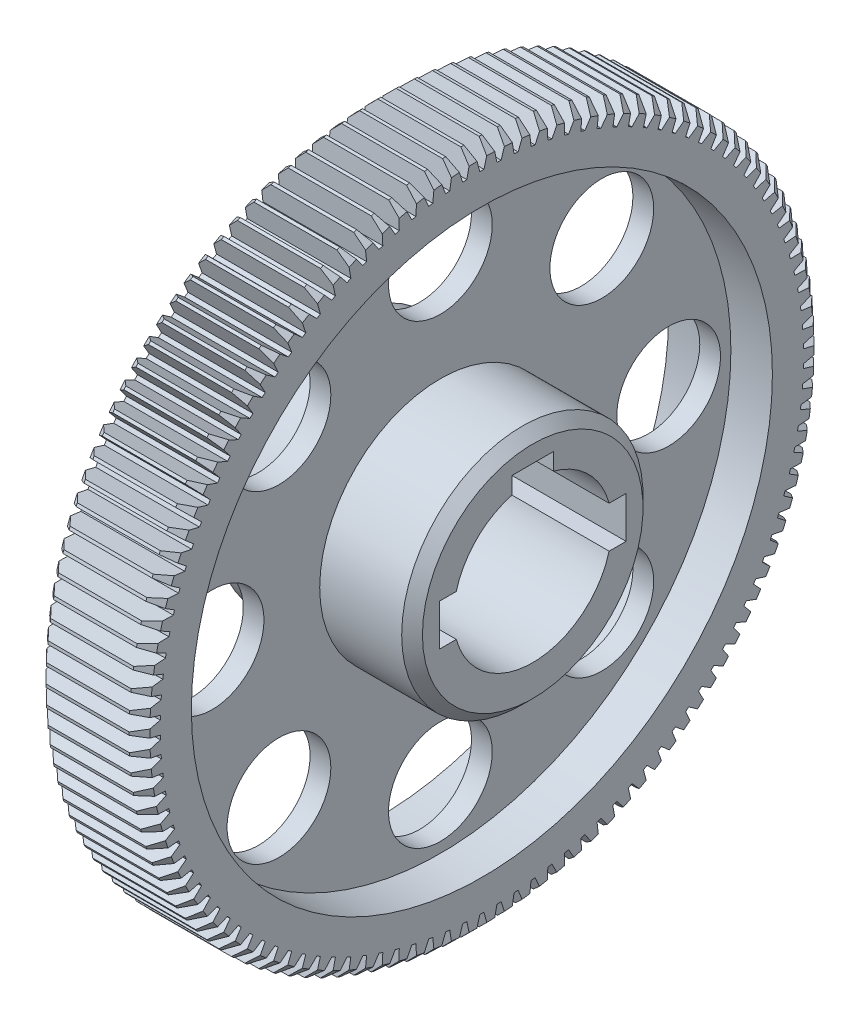
from build123d import *

# Parameters (mm, degrees)
CHAMFER_1_SIZE           = 5
SKETCH_3_R               = 25
CUT_EXTRUDE_1_DEPTH      = 10
CUT_EXTRUDE_2_REACH      = 255.478
SKETCH_4_W               = 20
SKETCH_4_H               = 45
PATTERN_CIRCULAR_1_COUNT = 4
CUT_EXTRUDE_3_REACH      = 246.949
PATTERN_CIRCULAR_2_COUNT = 118


with BuildPart() as part:
    # 草图2 → 旋转1 (revolve)
    with BuildSketch(Plane(origin=(0, 0, 0), x_dir=(1, 0, 0), z_dir=(0, 1, 0)), mode=Mode.PRIVATE) as revolve_1_sk:
        Polygon((-25, 165), (25, 165), (25, 140), (5, 140), (5, 58.15), (49.5, 58.15), (49.5, 38.15), (-49.5, 38.15), (-49.5, 58.15), (-5, 58.15), (-5, 140), (-25, 140), align=None)
    revolve(revolve_1_sk.sketch.rotate(Axis((0, 0, 0), (1, 0, 0)), 180), axis=Axis((0, 0, 0), (1, 0, 0)))

    # 倒角1
    chamfer_1_edges = [part.edges().sort_by_distance(p)[0] for p in [
        (-49.5, 0, -58.15),
        (49.5, 0, -58.15),
        (25, 0, -165),
        (-25, 0, -165),
    ]]
    chamfer(chamfer_1_edges, length=CHAMFER_1_SIZE)

    # 草图3 → 切除-拉伸1 (cut)
    with BuildSketch(Plane(origin=(5, 0, 0), x_dir=(0, 0, -1), z_dir=(1, 0, 0))):
        with Locations((0, 110)):
            Circle(SKETCH_3_R)
        with Locations((77.781745931, 77.781745931)):
            Circle(SKETCH_3_R)
        with Locations((110, 0)):
            Circle(SKETCH_3_R)
        with Locations((77.781745931, -77.781745931)):
            Circle(SKETCH_3_R)
        with Locations((0, -110)):
            Circle(SKETCH_3_R)
        with Locations((-77.781745931, -77.781745931)):
            Circle(SKETCH_3_R)
        with Locations((-110, 0)):
            Circle(SKETCH_3_R)
        with Locations((-77.781745931, 77.781745931)):
            Circle(SKETCH_3_R)
    extrude(amount=-CUT_EXTRUDE_1_DEPTH, mode=Mode.SUBTRACT)

    # 草图4 → 切除-拉伸2 (cut, up to next)
    with BuildSketch(Plane.ZY.offset(49.5), mode=Mode.PRIVATE) as cut_extrude_2_sk1:
        with Locations((0, 22.5)):
            Rectangle(SKETCH_4_W, SKETCH_4_H)
    cut_extrude_2_tool1 = extrude(cut_extrude_2_sk1.sketch, amount=-CUT_EXTRUDE_2_REACH, mode=Mode.PRIVATE) & part.part
    cut_extrude_2 = cut_extrude_2_tool1.solids().sort_by_distance((-49.5, 22.5, 0))[0]
    add(cut_extrude_2, mode=Mode.SUBTRACT)

    # 阵列(圆周)1: 切除-拉伸2 ×4 about axis, 1 skipped
    pattern_circular_1_axis = Axis((0, 0, 0), (1, 0, 0))
    add([cut_extrude_2.rotate(pattern_circular_1_axis, i * 360 / PATTERN_CIRCULAR_1_COUNT) for i in range(1, PATTERN_CIRCULAR_1_COUNT) if i not in (2,)], mode=Mode.SUBTRACT)

    # 草图5 → 切除-拉伸3 (cut, up to next)
    with BuildSketch(Plane(origin=(25, 0, 0), x_dir=(0, 0, -1), z_dir=(1, 0, 0)), mode=Mode.PRIVATE) as cut_extrude_3_sk1:
        with BuildLine():
            Line((-1, 154.99677416), (-3.669422072, 164.959192959))
            ThreePointArc((-3.669422072, 164.959192959), (0, 165), (3.669422072, 164.959192959))
            Line((3.669422072, 164.959192959), (1, 154.99677416))
            ThreePointArc((1, 154.99677416), (0, 155), (-1, 154.99677416))
        make_face()
    cut_extrude_3_tool1 = extrude(cut_extrude_3_sk1.sketch, amount=-CUT_EXTRUDE_3_REACH, mode=Mode.PRIVATE) & part.part
    cut_extrude_3 = cut_extrude_3_tool1.solids().sort_by_distance((25, 160.945054, 0))[0]
    add(cut_extrude_3, mode=Mode.SUBTRACT)

    # 阵列(圆周)2: 切除-拉伸3 ×118 about axis
    pattern_circular_2_axis = Axis((0, 0, 0), (1, 0, 0))
    for i in range(1, PATTERN_CIRCULAR_2_COUNT):
        add(cut_extrude_3.rotate(pattern_circular_2_axis, i * 360 / PATTERN_CIRCULAR_2_COUNT), mode=Mode.SUBTRACT)


solid = part.part
